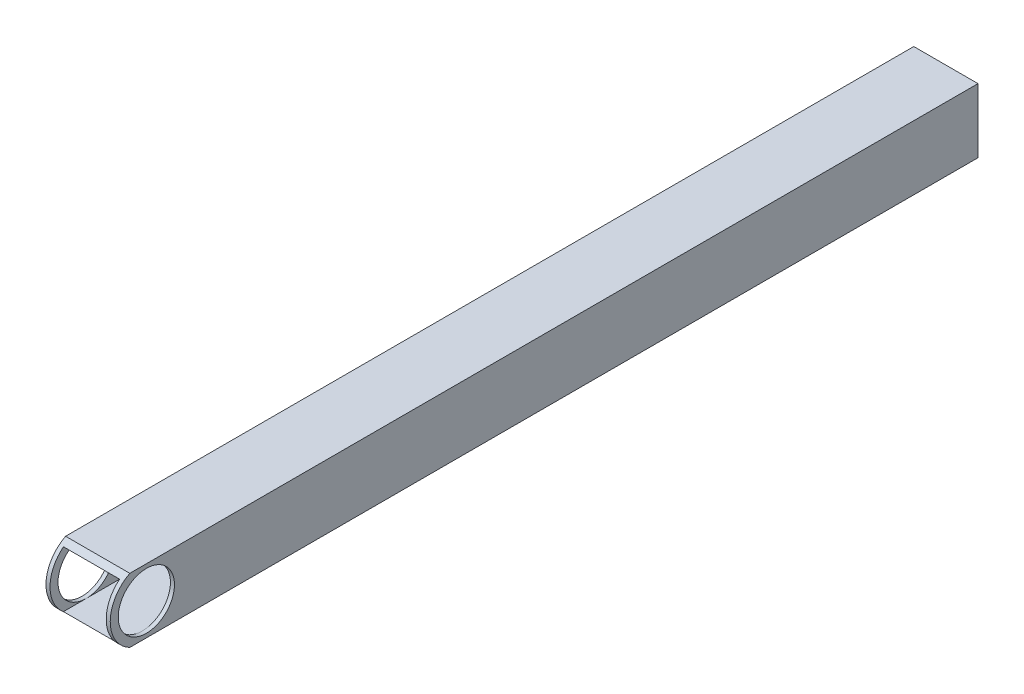
from build123d import *

# Parameters (mm, degrees)
SKETCH1_W           = 25.4
SKETCH1_H           = 25.4
SKETCH1_W_2         = 22.225
SKETCH1_H_2         = 22.225
EXTRUDE_THIN1_DEPTH = 173.99
SKETCH2_R           = 11.1125
CUT_EXTRUDE1_DEPTH  = 177.292285991
CUT_EXTRUDE2_DEPTH  = 177.292285991


with BuildPart() as part:
    # Sketch1 → Extrude-Thin1 (new, symmetric)
    with BuildSketch(Plane.XY):
        Rectangle(SKETCH1_W, SKETCH1_H)
        Rectangle(SKETCH1_W_2, SKETCH1_H_2, mode=Mode.SUBTRACT)
    extrude(amount=EXTRUDE_THIN1_DEPTH, both=True)

    # Sketch2 → Cut-Extrude1 (cut, through all)
    with BuildSketch(Plane(origin=(12.7, 0, 0), x_dir=(0, 0, -1), z_dir=(1, 0, 0))):
        with Locations((-154.94, 0)):
            Circle(SKETCH2_R)
    extrude(amount=-CUT_EXTRUDE1_DEPTH, mode=Mode.SUBTRACT)

    # Sketch3 → Cut-Extrude2 (cut, through all)
    with BuildSketch(Plane(origin=(12.7, 0, 0), x_dir=(0, 0, -1), z_dir=(1, 0, 0))):
        with BuildLine():
            Line((-154.94, 14.2875), (-173.99, 14.2875))
            Line((-173.99, 14.2875), (-173.99, -12.7))
            Line((-173.99, -12.7), (-161.485430181, -12.7))
            ThreePointArc((-161.485430181, -12.7), (-168.8249542, 3.367596045), (-154.94, 14.2875))
        make_face()
    extrude(amount=-CUT_EXTRUDE2_DEPTH, mode=Mode.SUBTRACT)


solid = part.part
